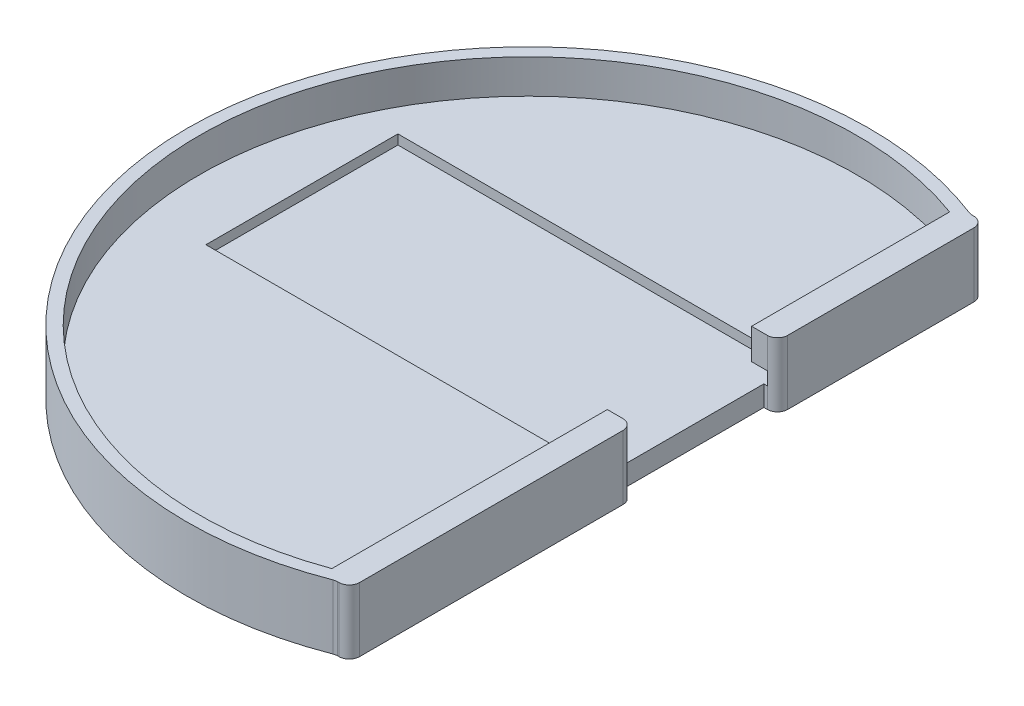
from build123d import *

# Parameters (mm, degrees)
SKETCH1_R               = 50
BOSS_EXTRUDE1_DEPTH     = 1.5
SKETCH2_R               = 50
SKETCH2_W               = 57.15
SKETCH2_H               = 28.15
BOSS_EXTRUDE2_DEPTH     = 1.415
BOSS_EXTRUDE3_START     = 5
BOSS_EXTRUDE3_DEPTH     = 5
CUT_EXTRUDE1_DEPTH      = 71.887234394
CUT_EXTRUDE1_DEPTH_BACK = 71.887234394
SKETCH6_W               = 1.8
SKETCH6_H               = 4.5
BOSS_EXTRUDE4_DEPTH     = 3.5
SKETCH7_W               = 1.8
SKETCH7_H               = 4.5
BOSS_EXTRUDE5_DEPTH     = 3.5
SKETCH8_W               = 30.276808401
SKETCH8_H               = 9.415
SKETCH8_W_2             = 41.626808401
BOSS_EXTRUDE6_DEPTH     = 2
SKETCH9_W               = 28.15
SKETCH9_H               = 1.915
CUT_EXTRUDE3_DEPTH      = 0.5
FILLET1_START           = -2
FILLET1_DEPTH           = 11
FILLET1_START_2         = -1.5
FILLET1_2_DEPTH         = 9.415


with BuildPart() as part:
    # Sketch1 → Boss-Extrude1 (new, symmetric)
    with BuildSketch(Plane(origin=(0, 0, 0), x_dir=(1, 0, 0), z_dir=(0, 1, 0))):
        with Locations(Location((0, 0, 0), (0, 0, 270))):
            Circle(SKETCH1_R)
    extrude(amount=BOSS_EXTRUDE1_DEPTH, both=True)

    # Sketch2 → Boss-Extrude2 (add, symmetric)
    with BuildSketch(Plane(origin=(0, 1.5, 0), x_dir=(1, 0, 0), z_dir=(0, 1, 0))):
        with Locations(Location((0, 0, 0), (0, 0, 270))):
            Circle(SKETCH2_R)
        with Locations((-10.265, 5.675)):
            Rectangle(SKETCH2_W, SKETCH2_H, mode=Mode.SUBTRACT)
    extrude(amount=BOSS_EXTRUDE2_DEPTH, both=True)

    # Sketch3 → Boss-Extrude3 (add)
    with BuildSketch(Plane(origin=(0, 2.915, 0), x_dir=(1, 0, 0), z_dir=(0, 1, 0)).offset(BOSS_EXTRUDE3_START)):
        with BuildLine():
            Line((16.51, 45.284212481), (16.51, 19.75))
            Line((16.51, 19.75), (18.31, 19.75))
            Line((18.31, 19.75), (18.31, 46.526808401))
            ThreePointArc((18.31, 46.526808401), (-50, 0), (18.31, -46.526808401))
            Line((18.31, -46.526808401), (18.31, -8.4))
            Line((18.31, -8.4), (16.51, -8.4))
            Line((16.51, -8.4), (16.51, -45.284212481))
            ThreePointArc((16.51, -45.284212481), (-48.2, 0), (16.51, 45.284212481))
        make_face()
    extrude(amount=-BOSS_EXTRUDE3_DEPTH)

    # Sketch4 → Cut-Extrude1 (cut, two sides: drawn at the far end of the back side and taken through both)
    with BuildSketch(Plane(origin=(0, 2.915, 0), x_dir=(1, 0, 0), z_dir=(0, 1, 0)).offset(-CUT_EXTRUDE1_DEPTH_BACK)):
        with BuildLine():
            Line((18.31, -46.526808401), (18.31, 46.526808401))
            ThreePointArc((18.31, 46.526808401), (50, 0), (18.31, -46.526808401))
        make_face()
    extrude(amount=CUT_EXTRUDE1_DEPTH + CUT_EXTRUDE1_DEPTH_BACK, mode=Mode.SUBTRACT)

    # Sketch6 → Boss-Extrude4 (add)
    with BuildSketch(Plane.XY.offset(-19.75)):
        with Locations((17.41, 5.665)):
            Rectangle(SKETCH6_W, SKETCH6_H)
    extrude(amount=BOSS_EXTRUDE4_DEPTH)

    # Sketch7 → Boss-Extrude5 (add)
    with BuildSketch(Plane(origin=(0, 0, 8.4), x_dir=(-1, 0, 0), z_dir=(0, 0, -1))):
        with Locations((-17.41, 5.665)):
            Rectangle(SKETCH7_W, SKETCH7_H)
    extrude(amount=BOSS_EXTRUDE5_DEPTH)

    # Sketch8 → Boss-Extrude6 (add)
    with BuildSketch(Plane(origin=(18.31, 0, 0), x_dir=(0, 0, -1), z_dir=(1, 0, 0))):
        with Locations((31.388404201, 3.2075)):
            Rectangle(SKETCH8_W, SKETCH8_H)
        with Locations((-25.713404201, 3.2075)):
            Rectangle(SKETCH8_W_2, SKETCH8_H)
    extrude(amount=BOSS_EXTRUDE6_DEPTH)

    # Sketch9 → Cut-Extrude3 (cut)
    with BuildSketch(Plane.ZY.offset(-18.31)):
        with Locations((-5.675, 2.4575)):
            Rectangle(SKETCH9_W, SKETCH9_H)
    extrude(amount=-CUT_EXTRUDE3_DEPTH, mode=Mode.SUBTRACT)

    # Fillet1: read off the stored shape, not the designer's step
    # Fillet1 outline → Fillet1 (cut)
    with BuildSketch(Plane(origin=(0, 0, 0), x_dir=(1, 0, 0), z_dir=(0, 1, 0)).offset(FILLET1_START)):
        with BuildLine():
            Line((20.31, -4.9), (18.81, -4.9))
            ThreePointArc((18.81, -4.9), (19.870660172, -5.339339828), (20.31, -6.4))
            Line((20.31, -6.4), (20.31, -4.9))
        make_face()
        with BuildLine():
            Line((20.31, 16.25), (20.31, 17.75))
            ThreePointArc((20.31, 17.75), (19.870660172, 16.689339828), (18.81, 16.25))
            Line((18.81, 16.25), (20.31, 16.25))
        make_face()
        with BuildLine():
            Line((20.31, 46.526808401), (18.81, 46.526808401))
            ThreePointArc((18.81, 46.526808401), (19.870660172, 46.087468573), (20.31, 45.026808401))
            Line((20.31, 45.026808401), (20.31, 46.526808401))
        make_face()
        with BuildLine():
            Line((20.31, -46.526808401), (20.31, -45.026808401))
            ThreePointArc((20.31, -45.026808401), (19.870660172, -46.087468573), (18.81, -46.526808401))
            Line((18.81, -46.526808401), (20.31, -46.526808401))
        make_face()
    extrude(amount=FILLET1_DEPTH, mode=Mode.SUBTRACT)

    # Fillet1 2 outline → Fillet1 2 (add)
    with BuildSketch(Plane(origin=(0, 0, 0), x_dir=(1, 0, 0), z_dir=(0, 1, 0)).offset(FILLET1_START_2)):
        with BuildLine():
            ThreePointArc((18.592355278, 46.526808401), (18.316908931, 46.552315502), (18.050830367, 46.627969322))
            ThreePointArc((18.050830367, 46.627969322), (18.180485544, 46.577569122), (18.31, 46.526808401))
            Line((18.31, 46.526808401), (18.592355278, 46.526808401))
        make_face()
        with BuildLine():
            ThreePointArc((18.050830367, -46.627969322), (18.316908931, -46.552315502), (18.592355278, -46.526808401))
            Line((18.592355278, -46.526808401), (18.31, -46.526808401))
            ThreePointArc((18.31, -46.526808401), (18.180485544, -46.577569122), (18.050830367, -46.627969322))
        make_face()
    extrude(amount=FILLET1_2_DEPTH)


solid = part.part
